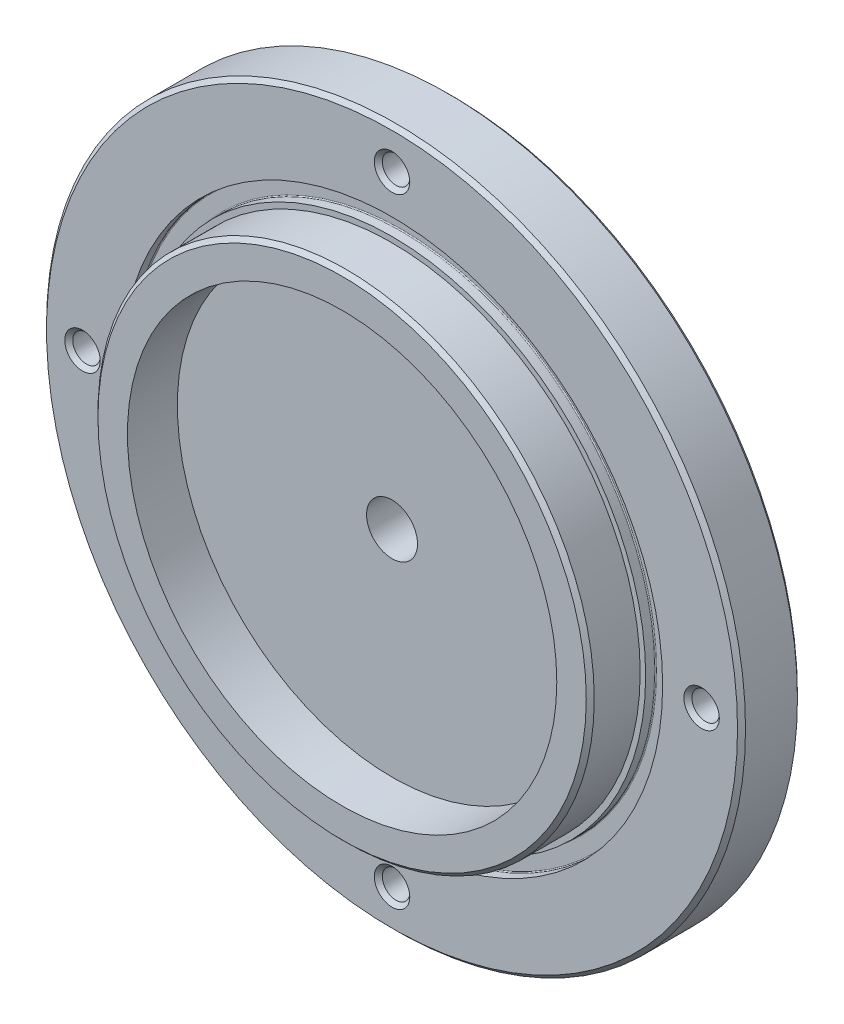
from build123d import *

# Parameters (mm, degrees)
SKETCH1_R           = 70
PLATE_DEPTH         = 12
SKETCH3_R           = 49.7
SKETCH3_R_2         = 43
SPIGOT_RING_DEPTH   = 10
CHAMFER_2_SIZE      = 0.8
SKETCH4_R           = 54.2
SKETCH4_R_2         = 50.8
FACE_GROOVE_DEPTH   = 2
FILLET1_R           = 0.2
ROD_HOLES_START     = -12
ROD_HOLES_OUTLINE_R = 2.75
ROD_HOLES_DEPTH     = 12
CHAMFER2_SIZE       = 0.8
P_C_D               = 10.2


# Read off the part's stored shape, not the designer's step: Rod_holes
with BuildPart() as part:
    # Sketch1 → PLATE (new body)
    with BuildSketch(Plane.XY):
        Circle(SKETCH1_R)
    extrude(amount=-PLATE_DEPTH)

    # Sketch3 → Spigot_Ring (add)
    with BuildSketch(Plane.XY):
        Circle(SKETCH3_R)
        Circle(SKETCH3_R_2, mode=Mode.SUBTRACT)
    extrude(amount=SPIGOT_RING_DEPTH)

    # Chamfer 2
    chamfer_2_edges = [part.edges().sort_by_distance(p)[0] for p in [
        (-49.7, 0, 10),
    ]]
    chamfer(chamfer_2_edges, length=CHAMFER_2_SIZE)

    # Sketch4 → Face_Groove (cut)
    with BuildSketch(Plane.XY):
        Circle(SKETCH4_R)
        Circle(SKETCH4_R_2, mode=Mode.SUBTRACT)
    extrude(amount=-FACE_GROOVE_DEPTH, mode=Mode.SUBTRACT)

    # Fillet1
    fillet1_edges = [part.edges().sort_by_distance(p)[0] for p in [
        (-54.2, 0, -2),
        (-50.8, 0, -2),
    ]]
    fillet(fillet1_edges, radius=FILLET1_R)

    # Rod_holes outline → Rod_holes (cut)
    with BuildSketch(Plane.XY.offset(ROD_HOLES_START)):
        with Locations((-62, 0)):
            Circle(ROD_HOLES_OUTLINE_R)
        with Locations((0, -62)):
            Circle(ROD_HOLES_OUTLINE_R)
        with Locations((62, 0)):
            Circle(ROD_HOLES_OUTLINE_R)
        with Locations((0, 62)):
            Circle(ROD_HOLES_OUTLINE_R)
    extrude(amount=ROD_HOLES_DEPTH, mode=Mode.SUBTRACT)

    # Chamfer2
    chamfer2_edges = [part.edges().sort_by_distance(p)[0] for p in [
        (-70, 0, 0),
        (-64.75, 0, 0),
        (-64.75, 0, -12),
        (-2.75, -62, 0),
        (-2.75, -62, -12),
        (59.25, 0, 0),
        (59.25, 0, -12),
        (-70, 0, -12),
        (-2.75, 62, 0),
        (-2.75, 62, -12),
    ]]
    chamfer(chamfer2_edges, length=CHAMFER2_SIZE)

    # P_C (through all)
    with Locations(Plane(origin=(0, 0, -12), x_dir=(-1, 0, 0), z_dir=(0, 0, -1))):
        with Locations((0, 0)):
            Hole(P_C_D / 2)


solid = part.part
